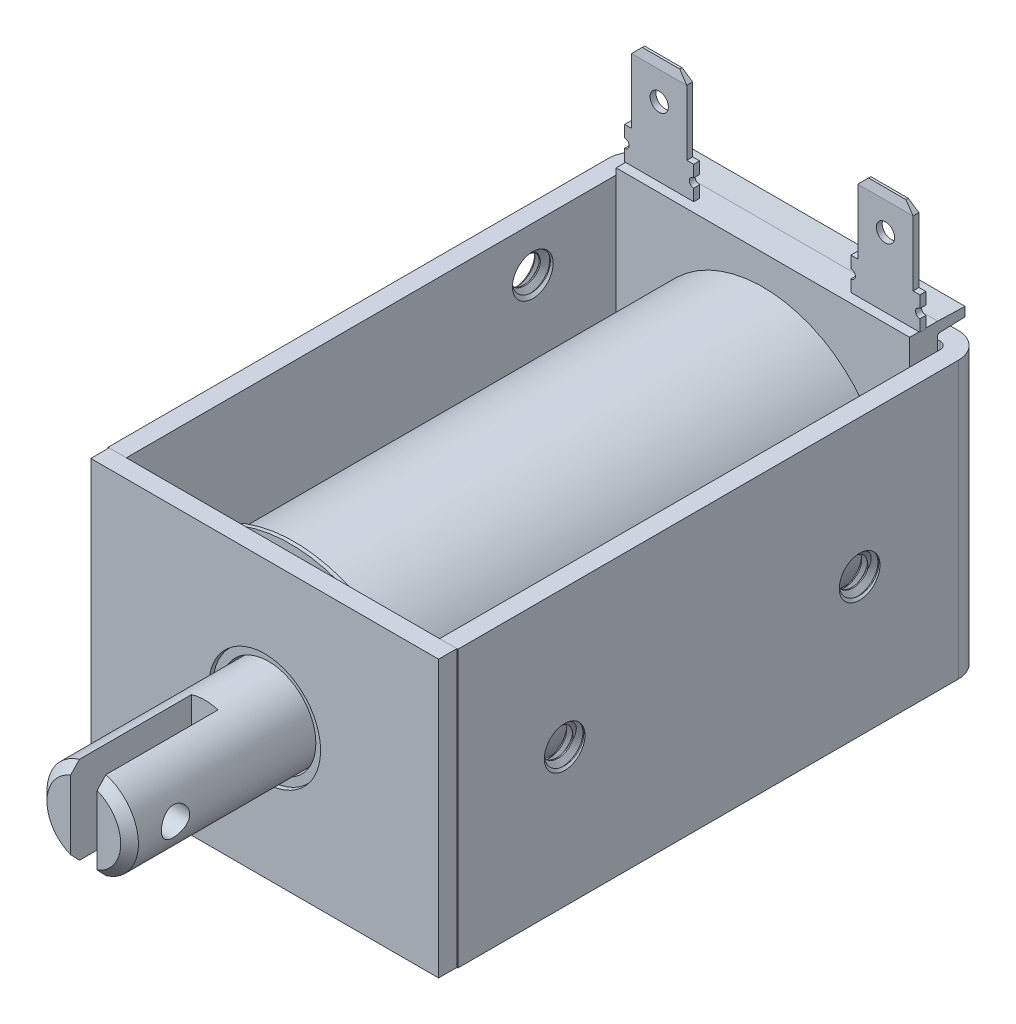
from build123d import *

# Parameters (mm, degrees)
BOSS_EXTRUDE1_DEPTH      = 11.8872
BOSS_EXTRUDE1_DEPTH_BACK = 11.8872
SKETCH3_W                = 29.9466
SKETCH3_H                = 1.5748
SKETCH4_R                = 4.8133
CUT_EXTRUDE1_DEPTH       = 1.5748
BOSS_EXTRUDE2_DEPTH      = 11.8872
BOSS_EXTRUDE2_DEPTH_BACK = 11.8872
SKETCH6_R                = 2.1082
CUT_EXTRUDE2_DEPTH       = 1.5748
BOSS_EXTRUDE3_START      = 13.4874
SKETCH7_R                = 1.7526
BOSS_EXTRUDE3_DEPTH      = 1.5748
CUT_SWEEP1_PITCH         = 0.79375
CUT_SWEEP1_HEIGHT        = 2.31775
CUT_SWEEP1_RADIUS        = 1.7526
CUT_SWEEP1_START_ANGLE   = -90
SKETCH10_R               = 1.7526
BOSS_EXTRUDE4_DEPTH      = 0.79375
BOSS_EXTRUDE4_DRAFT      = -45
SKETCH11_R               = 1.7526
BOSS_EXTRUDE5_DEPTH      = 0.79375
BOSS_EXTRUDE5_DRAFT      = -45
LPATTERN1_COUNT          = 2
LPATTERN1_PITCH          = 25.4
BOSS_EXTRUDE9_START      = -13.4874
SKETCH20_R               = 1.7526
BOSS_EXTRUDE9_DEPTH      = 1.5748
CUT_SWEEP2_PITCH         = 0.79375
CUT_SWEEP2_HEIGHT        = 2.36855
CUT_SWEEP2_RADIUS        = 1.7526
CUT_SWEEP2_START_ANGLE   = -90
SKETCH23_R               = 1.7526
BOSS_EXTRUDE10_DEPTH     = 0.79375
BOSS_EXTRUDE10_DRAFT     = -45
SKETCH24_R               = 1.7526
BOSS_EXTRUDE11_DEPTH     = 0.79375
BOSS_EXTRUDE11_DRAFT     = -45
LPATTERN2_COUNT          = 2
LPATTERN2_PITCH          = 26.120105777
SKETCH12_R               = 4.0767
BOSS_EXTRUDE6_DEPTH      = 2.413
BOSS_EXTRUDE7_DEPTH      = 12.6365
BOSS_EXTRUDE7_DEPTH_BACK = 12.6365
BOSS_EXTRUDE8_START      = -0.8128
SKETCH15_R               = 0.7874
BOSS_EXTRUDE8_DEPTH      = 0.508
CUT_EXTRUDE3_DEPTH       = 55.793306333
CUT_EXTRUDE3_DEPTH_BACK  = 55.793306333
CUT_EXTRUDE4_DEPTH       = 3.937
CUT_EXTRUDE4_DEPTH_BACK  = 3.937
SKETCH18_W               = 2.286
SKETCH18_H               = 10.414
CUT_EXTRUDE5_DEPTH       = 55.859621009
CUT_EXTRUDE5_DEPTH_BACK  = 55.859621009
SKETCH19_R               = 1.2192


with BuildPart() as part:
    # Sketch3 → Boss-Extrude1 (new, two sides: drawn at the far end of the back side and taken through both)
    with BuildSketch(Plane(origin=(0, 0, 0), x_dir=(1, 0, 0), z_dir=(0, 1, 0)).offset(-BOSS_EXTRUDE1_DEPTH_BACK)):
        with Locations((0, 0.7874)):
            Rectangle(SKETCH3_W, SKETCH3_H)
    extrude(amount=BOSS_EXTRUDE1_DEPTH + BOSS_EXTRUDE1_DEPTH_BACK)

    # Sketch4 → Cut-Extrude1 (cut)
    with BuildSketch(Plane(origin=(0, 0, 0), x_dir=(-1, 0, 0), z_dir=(0, 0, -1))):
        with Locations(Location((0, 0, 0), (0, 0, 180))):
            Circle(SKETCH4_R)
    extrude(amount=CUT_EXTRUDE1_DEPTH, mode=Mode.SUBTRACT)


with BuildPart() as body_2:
    # Sketch5 → Boss-Extrude2 (new, two sides: drawn at the far end of the back side and taken through both)
    with BuildSketch(Plane(origin=(0, 0, 0), x_dir=(1, 0, 0), z_dir=(0, 1, 0)).offset(-BOSS_EXTRUDE2_DEPTH_BACK)):
        with BuildLine():
            Line((-15.0622, 1.5748), (-15.0622, 44.6786))
            ThreePointArc((-15.0622, 44.6786), (-14.414964565, 46.241164565), (-12.8524, 46.8884))
            Line((-12.8524, 46.8884), (12.8524, 46.8884))
            ThreePointArc((12.8524, 46.8884), (14.414964565, 46.241164565), (15.0622, 44.6786))
            Line((15.0622, 44.6786), (15.0622, 1.5748))
            Line((15.0622, 1.5748), (13.4874, 1.5748))
            Line((13.4874, 1.5748), (13.4874, 44.6786))
            ThreePointArc((13.4874, 44.6786), (13.301412806, 45.127612806), (12.8524, 45.3136))
            Line((12.8524, 45.3136), (-12.8524, 45.3136))
            ThreePointArc((-12.8524, 45.3136), (-13.301412806, 45.127612806), (-13.4874, 44.6786))
            Line((-13.4874, 44.6786), (-13.4874, 1.5748))
            Line((-13.4874, 1.5748), (-15.0622, 1.5748))
        make_face()
    extrude(amount=BOSS_EXTRUDE2_DEPTH + BOSS_EXTRUDE2_DEPTH_BACK)

    # Sketch6 → Cut-Extrude2 (cut)
    with BuildSketch(Plane(origin=(0, 0, -46.8884), x_dir=(-1, 0, 0), z_dir=(0, 0, -1))):
        Circle(SKETCH6_R)
    extrude(amount=-CUT_EXTRUDE2_DEPTH, mode=Mode.SUBTRACT)


with BuildPart() as body_3:
    # Sketch7 → Boss-Extrude3 (new body)
    with BuildSketch(Plane(origin=(0, 0, 0), x_dir=(0, 0, -1), z_dir=(1, 0, 0)).offset(BOSS_EXTRUDE3_START)):
        with Locations(Location((36.1696, 0, 0), (0, 0, 180))):
            Circle(SKETCH7_R)
    extrude(amount=BOSS_EXTRUDE3_DEPTH)

    # Cut-Sweep1: sweep along a helix
    with BuildLine() as cut_sweep1_path:
        add(Helix(CUT_SWEEP1_PITCH, CUT_SWEEP1_HEIGHT, CUT_SWEEP1_RADIUS, center=(13.4874, 0, -36.1696), direction=(1, 0, 0), mode=Mode.PRIVATE).rotate(Axis((13.4874, 0, -36.1696), (1, 0, 0)), CUT_SWEEP1_START_ANGLE))
    # Sketch9 → Cut-Sweep1 (sweep, cut)
    with BuildSketch(Plane.XY.offset(-36.1696)):
        Polygon((13.090525, 1.237044252), (13.18974375, 1.237044252), (13.512204688, 1.795562979), (12.768064063, 1.795562979), align=None)
    sweep(path=cut_sweep1_path.line, is_frenet=True, mode=Mode.SUBTRACT)


with BuildPart() as boss_extrude4_tool:
    # Sketch10 → Boss-Extrude4 (with draft: the straight prism first)
    with BuildSketch(Plane.ZY.offset(-13.4874)):
        with Locations((-36.1696, 0)):
            Circle(SKETCH10_R)
    extrude(amount=-BOSS_EXTRUDE4_DEPTH)
    # Boss-Extrude4: the draft: its side faces are tilted about the plane it starts from
    boss_extrude4_sides = [boss_extrude4_tool.faces().sort_by_distance(p)[0] for p in [
        (13.884275, 0, -37.9222),
    ]]
    draft(boss_extrude4_sides, Plane.ZY.offset(-13.4874), BOSS_EXTRUDE4_DRAFT)


with BuildPart() as body_3_1:
    add(body_3.part)

    # Boss-Extrude4: add boss_extrude4_tool
    add(boss_extrude4_tool.part)


with BuildPart() as boss_extrude5_tool:
    # Sketch11 → Boss-Extrude5 (with draft: the straight prism first)
    with BuildSketch(Plane(origin=(15.0622, 0, 0), x_dir=(0, 0, -1), z_dir=(1, 0, 0))):
        with Locations((36.1696, 0)):
            Circle(SKETCH11_R)
    extrude(amount=-BOSS_EXTRUDE5_DEPTH)
    # Boss-Extrude5: the draft: its side faces are tilted about the plane it starts from
    boss_extrude5_sides = [boss_extrude5_tool.faces().sort_by_distance(p)[0] for p in [
        (14.665325, 0, -34.417),
    ]]
    draft(boss_extrude5_sides, Plane(origin=(15.0622, 0, 0), x_dir=(0, 0, -1), z_dir=(1, 0, 0)), BOSS_EXTRUDE5_DRAFT)


with BuildPart() as body_3_2:
    add(body_3_1.part)

    # Boss-Extrude5: add boss_extrude5_tool
    add(boss_extrude5_tool.part)


with BuildPart() as lpattern1_1:
    # LPattern1: pattern copy
    add(body_3_2.part.moved(Location(Vector(0, 0, 1) * (1 * LPATTERN1_PITCH))))


with BuildPart() as body_5:
    # Sketch20 → Boss-Extrude9 (new body)
    with BuildSketch(Plane(origin=(0, 0, 0), x_dir=(0, 0, -1), z_dir=(1, 0, 0)).offset(BOSS_EXTRUDE9_START)):
        with Locations((36.576, 8.0137)):
            Circle(SKETCH20_R)
    extrude(amount=-BOSS_EXTRUDE9_DEPTH)

    # Cut-Sweep2: sweep along a helix
    with BuildLine() as cut_sweep2_path:
        add(Helix(CUT_SWEEP2_PITCH, CUT_SWEEP2_HEIGHT, CUT_SWEEP2_RADIUS, center=(-13.4874, 8.0137, -36.576), direction=(-1, 0, 0), mode=Mode.PRIVATE).rotate(Axis((-13.4874, 8.0137, -36.576), (-1, 0, 0)), CUT_SWEEP2_START_ANGLE))
    # Sketch22 → Cut-Sweep2 (sweep, cut)
    with BuildSketch(Plane.XY.offset(-36.576)):
        Polygon((-13.18974375, 9.250744252), (-13.090525, 9.250744252), (-12.768064063, 9.809262979), (-13.512204688, 9.809262979), align=None)
    sweep(path=cut_sweep2_path.line, is_frenet=True, mode=Mode.SUBTRACT)


with BuildPart() as boss_extrude10_tool:
    # Sketch23 → Boss-Extrude10 (with draft: the straight prism first)
    with BuildSketch(Plane(origin=(-13.4874, 0, 0), x_dir=(0, 0, -1), z_dir=(1, 0, 0))):
        with Locations((36.576, 8.0137)):
            Circle(SKETCH23_R)
    extrude(amount=-BOSS_EXTRUDE10_DEPTH)
    # Boss-Extrude10: the draft: its side faces are tilted about the plane it starts from
    boss_extrude10_sides = [boss_extrude10_tool.faces().sort_by_distance(p)[0] for p in [
        (-13.884275, 8.0137, -34.8234),
    ]]
    draft(boss_extrude10_sides, Plane(origin=(-13.4874, 0, 0), x_dir=(0, 0, -1), z_dir=(1, 0, 0)), BOSS_EXTRUDE10_DRAFT)


with BuildPart() as body_5_1:
    add(body_5.part)

    # Boss-Extrude10: add boss_extrude10_tool
    add(boss_extrude10_tool.part)


with BuildPart() as boss_extrude11_tool:
    # Sketch24 → Boss-Extrude11 (with draft: the straight prism first)
    with BuildSketch(Plane.ZY.offset(15.0622)):
        with Locations((-36.576, 8.0137)):
            Circle(SKETCH24_R)
    extrude(amount=-BOSS_EXTRUDE11_DEPTH)
    # Boss-Extrude11: the draft: its side faces are tilted about the plane it starts from
    boss_extrude11_sides = [boss_extrude11_tool.faces().sort_by_distance(p)[0] for p in [
        (-14.665325, 8.0137, -38.3286),
    ]]
    draft(boss_extrude11_sides, Plane.ZY.offset(15.0622), BOSS_EXTRUDE11_DRAFT)


with BuildPart() as body_5_2:
    add(body_5_1.part)

    # Boss-Extrude11: add boss_extrude11_tool
    add(boss_extrude11_tool.part)


with BuildPart() as lpattern2_1:
    # LPattern2: pattern copy
    add(body_5_2.part.moved(Location(Vector(0, -0.613603946969177, 0.7896139539444876) * (1 * LPATTERN2_PITCH))))


with BuildPart() as body_2_1:
    add(body_2.part)

    # Combine1: cut body 3, LPattern1_1, LPattern2_1, body 5
    add(body_3_2.part, mode=Mode.SUBTRACT)
    add(lpattern1_1.part, mode=Mode.SUBTRACT)
    add(lpattern2_1.part, mode=Mode.SUBTRACT)
    add(body_5_2.part, mode=Mode.SUBTRACT)


with BuildPart() as body_3_2_1:
    # Sketch12 → Boss-Extrude6 (new body)
    with BuildSketch(Plane.XY.offset(-45.3136)):
        with BuildLine():
            Line((-12.6365, 13.2715), (12.6365, 13.2715))
            Line((12.6365, 13.2715), (12.6365, -8.6995))
            ThreePointArc((12.6365, -8.6995), (11.70656403, -10.94456403), (9.4615, -11.8745))
            Line((9.4615, -11.8745), (-9.4615, -11.8745))
            ThreePointArc((-9.4615, -11.8745), (-11.70656403, -10.94456403), (-12.6365, -8.6995))
            Line((-12.6365, -8.6995), (-12.6365, 13.2715))
        make_face()
        Circle(SKETCH12_R, mode=Mode.SUBTRACT)
    extrude(amount=BOSS_EXTRUDE6_DEPTH)

    # Sketch13 → Boss-Extrude7 (add, two sides: drawn at the far end of the back side and taken through both)
    with BuildSketch(Plane(origin=(0, 0, 0), x_dir=(0, 0, -1), z_dir=(1, 0, 0)).offset(-BOSS_EXTRUDE7_DEPTH_BACK)):
        with BuildLine():
            Line((45.3136, 13.2715), (47.6758, 13.195201373))
            Line((47.6758, 13.195201373), (47.6758, 12.407801373))
            Line((47.6758, 12.407801373), (45.461080074, 12.336266325))
            ThreePointArc((45.461080074, 12.336266325), (45.356511286, 12.289955108), (45.3136, 12.183945761))
            Line((45.3136, 12.183945761), (45.3136, 13.2715))
        make_face()
    extrude(amount=BOSS_EXTRUDE7_DEPTH + BOSS_EXTRUDE7_DEPTH_BACK)

    # Sketch14 → Revolve1 (revolve)
    with BuildSketch(Plane(origin=(0, 0, 0), x_dir=(0, 0, -1), z_dir=(1, 0, 0)), mode=Mode.PRIVATE) as revolve1_sk:
        Polygon((42.9006, 4.0767), (42.9006, 10.7061), (2.54, 10.7061), (2.54, 11.8999), (2.2098, 11.8999), (2.2098, 9.525), (1.905, 9.525), (1.905, 4.76631), (0.3302, 4.76631), (0.3302, 4.0767), align=None)
    revolve(revolve1_sk.sketch.rotate(Axis((0, 0, 0), (0, 0, -1)), 90), axis=Axis((0, 0, 0), (0, 0, -1)))

    # Sketch15 → Boss-Extrude8 (add)
    # profile 1 of 2: a face of its own
    with BuildSketch(Plane.XY.offset(-42.9006).offset(BOSS_EXTRUDE8_START)):
        with BuildLine():
            Line((6.7691, 13.2715), (12.7127, 13.2715))
            Line((12.7127, 13.2715), (12.7127, 14.2875))
            ThreePointArc((12.7127, 14.2875), (12.3317, 14.6685), (12.7127, 15.0495))
            Line((12.7127, 15.0495), (12.7127, 16.0655))
            Line((12.7127, 16.0655), (12.1158, 16.0655))
            Line((12.1158, 16.0655), (12.1158, 21.6535))
            Line((12.1158, 21.6535), (11.3538, 22.4155))
            Line((11.3538, 22.4155), (8.128, 22.4155))
            Line((8.128, 22.4155), (7.366, 21.6535))
            Line((7.366, 21.6535), (7.366, 16.0655))
            Line((7.366, 16.0655), (6.7691, 16.0655))
            Line((6.7691, 16.0655), (6.7691, 15.0495))
            ThreePointArc((6.7691, 15.0495), (7.1501, 14.6685), (6.7691, 14.2875))
            Line((6.7691, 14.2875), (6.7691, 13.2715))
        make_face()
        with Locations((9.7409, 19.2405)):
            Circle(SKETCH15_R, mode=Mode.SUBTRACT)
    # profile 2 of 2: a face of its own
    with BuildSketch(Plane.XY.offset(-42.9006).offset(BOSS_EXTRUDE8_START)):
        with BuildLine():
            Line((-12.7127, 13.2715), (-12.7127, 14.2875))
            ThreePointArc((-12.7127, 14.2875), (-12.3317, 14.6685), (-12.7127, 15.0495))
            Line((-12.7127, 15.0495), (-12.7127, 16.0655))
            Line((-12.7127, 16.0655), (-12.1158, 16.0655))
            Line((-12.1158, 16.0655), (-12.1158, 21.6535))
            Line((-12.1158, 21.6535), (-11.3538, 22.4155))
            Line((-11.3538, 22.4155), (-8.128, 22.4155))
            Line((-8.128, 22.4155), (-7.366, 21.6535))
            Line((-7.366, 21.6535), (-7.366, 16.0655))
            Line((-7.366, 16.0655), (-6.7691, 16.0655))
            Line((-6.7691, 16.0655), (-6.7691, 15.0495))
            ThreePointArc((-6.7691, 15.0495), (-7.1501, 14.6685), (-6.7691, 14.2875))
            Line((-6.7691, 14.2875), (-6.7691, 13.2715))
            Line((-6.7691, 13.2715), (-12.7127, 13.2715))
        make_face()
        with Locations(Location((-9.7409, 19.2405, 0), (0, 0, 180))):
            Circle(SKETCH15_R, mode=Mode.SUBTRACT)
    extrude(amount=-BOSS_EXTRUDE8_DEPTH)

    # Sketch16 → Cut-Extrude3 (cut, two sides: drawn at the far end of the back side and taken through both)
    with BuildSketch(Plane(origin=(0, 0, 0), x_dir=(0, 0, -1), z_dir=(1, 0, 0)).offset(-CUT_EXTRUDE3_DEPTH_BACK)):
        Polygon((43.7134, 22.4155), (43.7134, 21.6535), (43.8658, 22.4155), align=None)
        Polygon((44.069, 22.4155), (44.2214, 21.6535), (44.2214, 22.4155), align=None)
    extrude(amount=CUT_EXTRUDE3_DEPTH + CUT_EXTRUDE3_DEPTH_BACK, mode=Mode.SUBTRACT)


with BuildPart() as body_4:
    # Sketch17 → Revolve2 (revolve)
    with BuildSketch(Plane(origin=(0, 0, 0), x_dir=(0, 0, -1), z_dir=(1, 0, 0)), mode=Mode.PRIVATE) as revolve2_sk:
        Polygon((-15.5702, 0), (47.752, 0), (47.752, 2.032), (45.212, 2.032), (45.212, 3.9751), (31.8262, 3.9751), (31.8262, 3.937), (-14.8082, 3.937), (-15.5702, 3.175), align=None)
    revolve(revolve2_sk.sketch.rotate(Axis((0, 0, 15.5702), (0, 0, -1)), 180), axis=Axis((0, 0, 15.5702), (0, 0, -1)))

    # Sketch18 → Cut-Extrude4 (cut, two sides: drawn at the far end of the back side and taken through both)
    with BuildSketch(Plane(origin=(0, 0, 0), x_dir=(1, 0, 0), z_dir=(0, 1, 0)).offset(-CUT_EXTRUDE4_DEPTH_BACK)):
        with Locations((0, -10.3632)):
            Rectangle(SKETCH18_W, SKETCH18_H)
    extrude(amount=CUT_EXTRUDE4_DEPTH + CUT_EXTRUDE4_DEPTH_BACK, mode=Mode.SUBTRACT)

    # Sketch19 → Cut-Extrude5 (cut, two sides: drawn at the far end of the back side and taken through both)
    with BuildSketch(Plane(origin=(0, 0, 0), x_dir=(0, 0, -1), z_dir=(1, 0, 0)).offset(-CUT_EXTRUDE5_DEPTH_BACK)):
        with Locations((-11.6078, 0)):
            Circle(SKETCH19_R)
    extrude(amount=CUT_EXTRUDE5_DEPTH + CUT_EXTRUDE5_DEPTH_BACK, mode=Mode.SUBTRACT)


solid = Compound([part.part, body_2_1.part, body_3_2_1.part, body_4.part])
